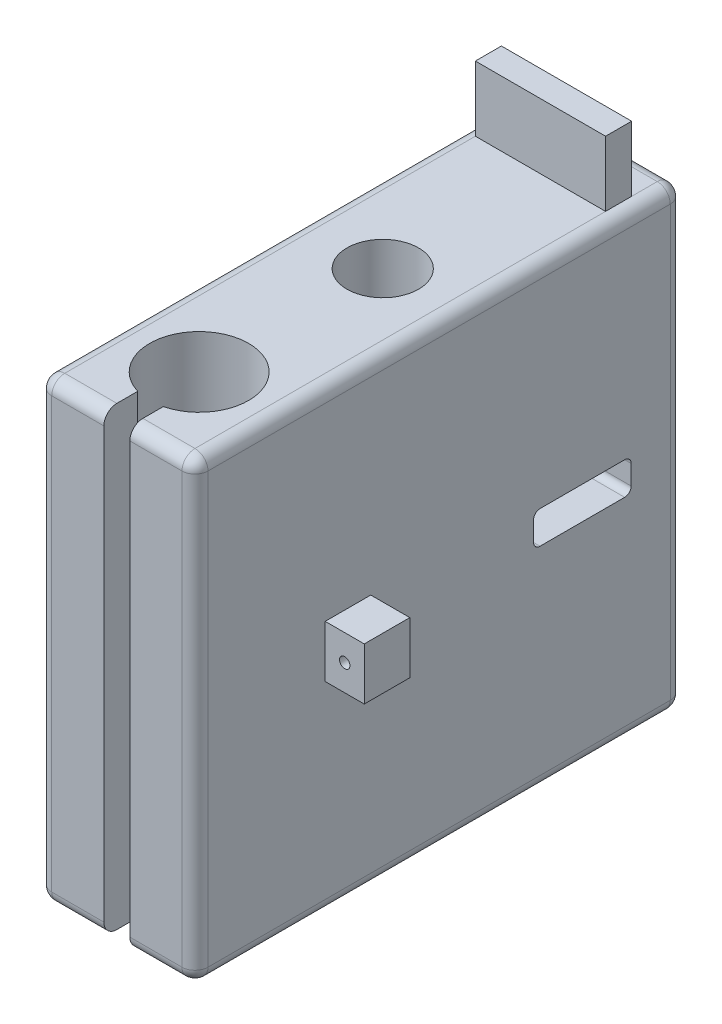
from build123d import *

# Parameters (mm, degrees)
RESSALTO_EXTRUS_O1_DEPTH                   = 12
RESSALTO_EXTRUS_O1_DEPTH_BACK              = 12
ESBO_O1_W                                  = 75
ESBO_O1_H                                  = 70
ESBO_O3_R                                  = 5.5
CORTE_EXTRUS_O1_DEPTH                      = 525.799189678
ESBO_O4_R                                  = 4.1
CORTE_EXTRUS_O2_DEPTH                      = 20
FILETE1_R                                  = 2
CORTE_EXTRUS_O3_DEPTH                      = 29
CORTE_EXTRUS_O4_DEPTH                      = 28
RESSALTO_EXTRUS_O2_DEPTH                   = 6
RESSALTO_EXTRUS_O2_DEPTH_BACK              = 30
ESBO_O7_W                                  = 7
ESBO_O7_H                                  = 8
BROCA_DE_ROSQUEAR_PARA_TARRAXA_DE_M2X0_4_D = 1.6
BROCA_DE_ROSQUEAR_PARA_TARRAXA_DE_M2_2_D   = 1.6
ESBO_O18_W                                 = 20
ESBO_O18_H                                 = 4
RESSALTO_EXTRUS_O3_DEPTH                   = 10


with BuildPart() as part:
    # Esboço1 → Ressalto-extrusão1 (new, two sides: drawn at the far end of the back side and taken through both)
    with BuildSketch(Plane(origin=(-220, 0, 0), x_dir=(0, 0, -1), z_dir=(1, 0, 0)).offset(-RESSALTO_EXTRUS_O1_DEPTH_BACK)):
        with Locations((-427.999935002, 213.253952806)):
            Rectangle(ESBO_O1_W, ESBO_O1_H)
    extrude(amount=RESSALTO_EXTRUS_O1_DEPTH + RESSALTO_EXTRUS_O1_DEPTH_BACK)

    # Esboço3 → Corte-extrusão1 (cut, through all)
    with BuildSketch(Plane(origin=(0, 248.253952806, 0), x_dir=(1, 0, 0), z_dir=(0, 1, 0))):
        with Locations((-219.508549322, -425.149935105)):
            Circle(ESBO_O3_R)
        with BuildLine():
            Line((-220, -465.499935002), (-218, -465.499935002))
            Line((-218, -465.499935002), (-218, -460.369179456))
            ThreePointArc((-218, -460.369179456), (-219.711945476, -445.401349285), (-222, -460.292000844))
            Line((-222, -460.292000844), (-222, -465.499935002))
            Line((-222, -465.499935002), (-220, -465.499935002))
        make_face()
    extrude(amount=-CORTE_EXTRUS_O1_DEPTH, mode=Mode.SUBTRACT)

    # Esboço4 → Corte-extrusão2 (cut)
    with BuildSketch(Plane(origin=(0, 0, 390.499935002), x_dir=(-1, 0, 0), z_dir=(0, 0, -1))):
        with Locations((219.858557552, 238.253952806)):
            Circle(ESBO_O4_R)
        with Locations((219.858557552, 188.253952806)):
            Circle(ESBO_O4_R)
    extrude(amount=-CORTE_EXTRUS_O2_DEPTH, mode=Mode.SUBTRACT)

    # Filete1
    filete1_edges = [part.edges().sort_by_distance(p)[0] for p in [
        (-227, 178.253952806, 465.499935002),
        (-213, 178.253952806, 465.499935002),
        (-213, 248.253952806, 465.499935002),
        (-227, 248.253952806, 465.499935002),
        (-208, 178.253952806, 427.999935002),
        (-208, 248.253952806, 427.999935002),
        (-208, 213.253952806, 465.499935002),
        (-232, 178.253952806, 427.999935002),
        (-232, 213.253952806, 465.499935002),
        (-232, 248.253952806, 427.999935002),
        (-220, 248.253952806, 390.499935002),
        (-220, 178.253952806, 390.499935002),
        (-208, 213.253952806, 390.499935002),
        (-232, 213.253952806, 390.499935002),
    ]]
    fillet(filete1_edges, radius=FILETE1_R)

    # Esboço5 → Corte-extrusão3 (cut)
    with BuildSketch(Plane(origin=(0, 0, 390.499935002), x_dir=(-1, 0, 0), z_dir=(0, 0, -1))):
        Polygon((214.017917835, 195.258505704), (226.017913806, 195.248671497), (226.047416426, 231.248659408), (214.047420456, 231.258493615), align=None)
    extrude(amount=-CORTE_EXTRUS_O3_DEPTH, mode=Mode.SUBTRACT)

    # Esboço6 → Corte-extrusão4 (cut)
    with BuildSketch(Plane.ZY.offset(232)):
        with BuildLine():
            Line((399.499935002, 215.753952806), (412.499935002, 215.753952806))
            ThreePointArc((412.499935002, 215.753952806), (413.207041783, 215.461059587), (413.499935002, 214.753952806))
            Line((413.499935002, 214.753952806), (413.499935002, 211.753952806))
            ThreePointArc((413.499935002, 211.753952806), (413.207041783, 211.046846025), (412.499935002, 210.753952806))
            Line((412.499935002, 210.753952806), (399.499935002, 210.753952806))
            ThreePointArc((399.499935002, 210.753952806), (398.792828221, 211.046846025), (398.499935002, 211.753952806))
            Line((398.499935002, 211.753952806), (398.499935002, 214.753952806))
            ThreePointArc((398.499935002, 214.753952806), (398.792828221, 215.461059587), (399.499935002, 215.753952806))
        make_face()
    extrude(amount=-CORTE_EXTRUS_O4_DEPTH, mode=Mode.SUBTRACT)

    # Esboço7 → Ressalto-extrusão2 (add, two sides: drawn at the far end of the back side and taken through both)
    with BuildSketch(Plane(origin=(-208, 0, 0), x_dir=(0, 0, -1), z_dir=(1, 0, 0)).offset(-RESSALTO_EXTRUS_O2_DEPTH_BACK)):
        with Locations((-441.999935002, 213.253952806)):
            Rectangle(ESBO_O7_W, ESBO_O7_H)
    extrude(amount=RESSALTO_EXTRUS_O2_DEPTH + RESSALTO_EXTRUS_O2_DEPTH_BACK)

    # Broca de rosquear para tarraxa de M2x0.4 (through all)
    with Locations(Plane.XY.offset(445.499935002)):
        with Locations((-205, 213.253952806)):
            Hole(BROCA_DE_ROSQUEAR_PARA_TARRAXA_DE_M2X0_4_D / 2)

    # Broca de rosquear para tarraxa de M2 2 (through all)
    with Locations(Plane.XY.offset(445.499935002)):
        with Locations((-235, 213.253952806)):
            Hole(BROCA_DE_ROSQUEAR_PARA_TARRAXA_DE_M2_2_D / 2)

    # Esboço18 → Ressalto-extrusão3 (add)
    with BuildSketch(Plane(origin=(0, 248.253952806, 0), x_dir=(1, 0, 0), z_dir=(0, 1, 0))):
        with Locations((-220, -398.434558943)):
            Rectangle(ESBO_O18_W, ESBO_O18_H)
    extrude(amount=RESSALTO_EXTRUS_O3_DEPTH)


solid = part.part
